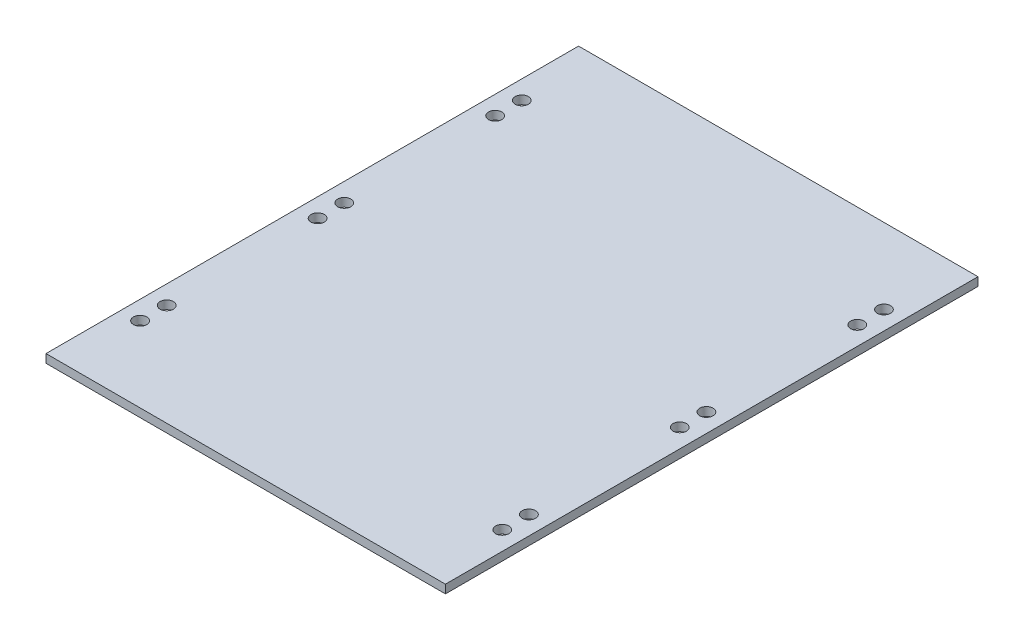
from build123d import *

# Parameters (mm, degrees)
SKETCH1_W           = 150
SKETCH1_H           = 200
SKETCH1_R           = 2.5
BOSS_EXTRUDE1_DEPTH = 3.175


with BuildPart() as part:
    # Sketch1 → Boss-Extrude1 (new body)
    with BuildSketch(Plane(origin=(0, 0, 0), x_dir=(1, 0, 0), z_dir=(0, 1, 0))):
        Rectangle(SKETCH1_W, SKETCH1_H)
        with Locations((-68, -61.666666667)):
            Circle(SKETCH1_R, mode=Mode.SUBTRACT)
        with Locations((-68, -71.666666667)):
            Circle(SKETCH1_R, mode=Mode.SUBTRACT)
        with Locations((-68, 5)):
            Circle(SKETCH1_R, mode=Mode.SUBTRACT)
        with Locations((-68, -5)):
            Circle(SKETCH1_R, mode=Mode.SUBTRACT)
        with Locations((-68, 71.666666667)):
            Circle(SKETCH1_R, mode=Mode.SUBTRACT)
        with Locations((-68, 61.666666667)):
            Circle(SKETCH1_R, mode=Mode.SUBTRACT)
        with Locations((68, 61.666666667)):
            Circle(SKETCH1_R, mode=Mode.SUBTRACT)
        with Locations((68, 71.666666667)):
            Circle(SKETCH1_R, mode=Mode.SUBTRACT)
        with Locations((68, -5)):
            Circle(SKETCH1_R, mode=Mode.SUBTRACT)
        with Locations((68, 5)):
            Circle(SKETCH1_R, mode=Mode.SUBTRACT)
        with Locations((68, -71.666666667)):
            Circle(SKETCH1_R, mode=Mode.SUBTRACT)
        with Locations((68, -61.666666667)):
            Circle(SKETCH1_R, mode=Mode.SUBTRACT)
    extrude(amount=BOSS_EXTRUDE1_DEPTH)


solid = part.part
